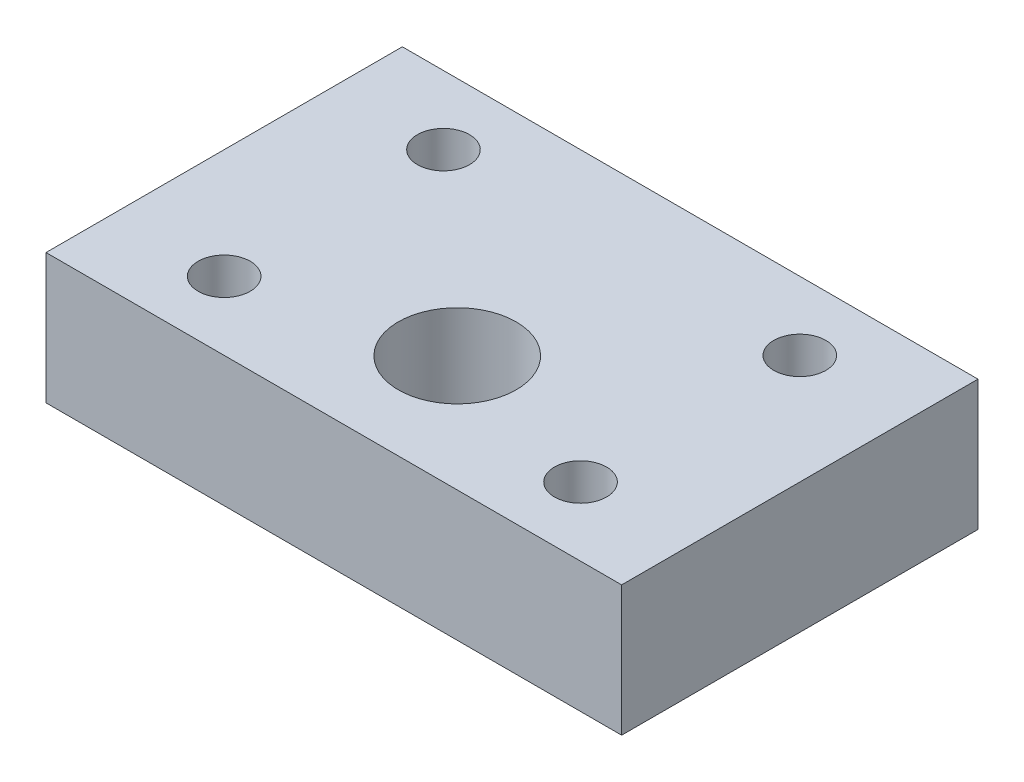
from build123d import *

# Parameters (mm, degrees)
SKETCH_1_W          = 42
SKETCH_1_H          = 26
EXTRUDE_1_DEPTH     = 9.5
SKETCH_6_R          = 4.3
CUT_EXTRUDE_1_DEPTH = 27.462237245
SKETCH_8_R          = 1.9
CUT_EXTRUDE_3_DEPTH = 27.462237245


with BuildPart() as part:
    # 草图1 → 凸台-拉伸1 (new body)
    with BuildSketch(Plane(origin=(0, 0, 0), x_dir=(1, 0, 0), z_dir=(0, 1, 0))):
        Rectangle(SKETCH_1_W, SKETCH_1_H)
    extrude(amount=EXTRUDE_1_DEPTH)

    # 草图6 → 切除-拉伸1 (cut, through all)
    with BuildSketch(Plane.XZ):
        with Locations((0.53, 4.526194604)):
            Circle(SKETCH_6_R)
    extrude(amount=-CUT_EXTRUDE_1_DEPTH, mode=Mode.SUBTRACT)

    # 草图8 → 切除-拉伸3 (cut, through all)
    with BuildSketch(Plane.XZ):
        with Locations((-13, 8)):
            Circle(SKETCH_8_R)
        with Locations((13, 8)):
            Circle(SKETCH_8_R)
        with Locations((-13, -8)):
            Circle(SKETCH_8_R)
        with Locations((13, -8)):
            Circle(SKETCH_8_R)
    extrude(amount=-CUT_EXTRUDE_3_DEPTH, mode=Mode.SUBTRACT)


solid = part.part
